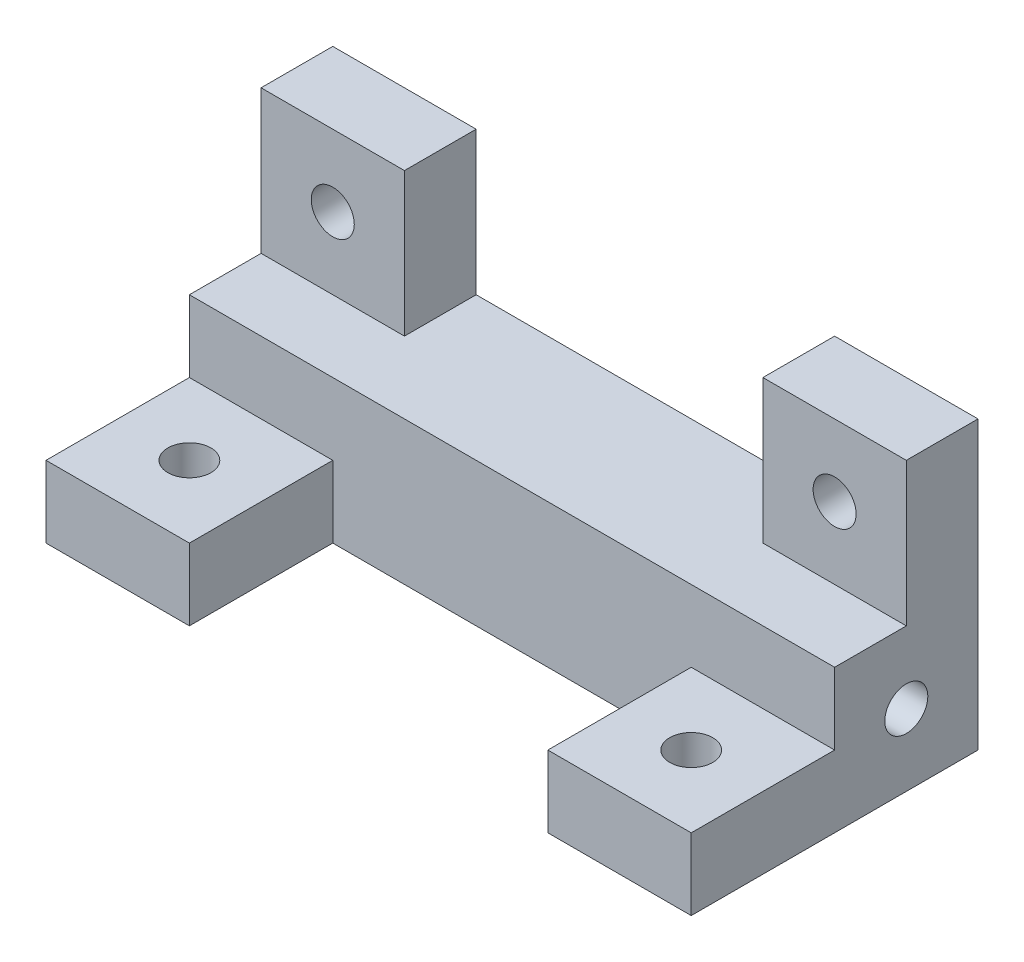
from build123d import *

# Parameters (mm, degrees)
SKETCH1_W           = 45
SKETCH1_H           = 10
BOSS_EXTRUDE1_DEPTH = 10
SKETCH2_W           = 10
SKETCH2_H           = 5
BOSS_EXTRUDE2_DEPTH = 10
SKETCH3_W           = 10
SKETCH3_H           = 5
BOSS_EXTRUDE3_DEPTH = 10
SKETCH4_R           = 1.5
CUT_EXTRUDE1_DEPTH  = 5
SKETCH5_R           = 1.5
CUT_EXTRUDE2_DEPTH  = 5
SKETCH6_R           = 1.5
CUT_EXTRUDE3_DEPTH  = 5
CUT_EXTRUDE4_START  = -5
SKETCH7_R           = 1.5
CUT_EXTRUDE4_DEPTH  = 5
SKETCH8_R           = 1.5
CUT_EXTRUDE5_DEPTH  = 5
SKETCH9_R           = 1.5
CUT_EXTRUDE6_DEPTH  = 5


with BuildPart() as part:
    # Sketch1 → Boss-Extrude1 (new body)
    with BuildSketch(Plane.XY):
        with Locations((22.5, 5)):
            Rectangle(SKETCH1_W, SKETCH1_H)
    extrude(amount=BOSS_EXTRUDE1_DEPTH)

    # Sketch2 → Boss-Extrude2 (add)
    with BuildSketch(Plane(origin=(0, 10, 0), x_dir=(1, 0, 0), z_dir=(0, 1, 0))):
        with Locations((5, -2.5)):
            Rectangle(SKETCH2_W, SKETCH2_H)
        with Locations((40, -2.5)):
            Rectangle(SKETCH2_W, SKETCH2_H)
    extrude(amount=BOSS_EXTRUDE2_DEPTH)

    # Sketch3 → Boss-Extrude3 (add)
    with BuildSketch(Plane.XY.offset(10)):
        with Locations((5, 2.5)):
            Rectangle(SKETCH3_W, SKETCH3_H)
        with Locations((40, 2.5)):
            Rectangle(SKETCH3_W, SKETCH3_H)
    extrude(amount=BOSS_EXTRUDE3_DEPTH)

    # Sketch4 → Cut-Extrude1 (cut)
    with BuildSketch(Plane.ZY):
        with Locations((5, 5)):
            Circle(SKETCH4_R)
    extrude(amount=-CUT_EXTRUDE1_DEPTH, mode=Mode.SUBTRACT)

    # Sketch5 → Cut-Extrude2 (cut)
    with BuildSketch(Plane.XY.offset(5)):
        with Locations((5, 15)):
            Circle(SKETCH5_R)
    extrude(amount=-CUT_EXTRUDE2_DEPTH, mode=Mode.SUBTRACT)

    # Sketch6 → Cut-Extrude3 (cut)
    with BuildSketch(Plane(origin=(0, 5, 0), x_dir=(1, 0, 0), z_dir=(0, 1, 0))):
        with Locations((5, -15)):
            Circle(SKETCH6_R)
    extrude(amount=-CUT_EXTRUDE3_DEPTH, mode=Mode.SUBTRACT)

    # Sketch7 → Cut-Extrude4 (cut)
    with BuildSketch(Plane(origin=(45, 0, 0), x_dir=(0, 0, -1), z_dir=(1, 0, 0)).offset(CUT_EXTRUDE4_START)):
        with Locations((-5, 5)):
            Circle(SKETCH7_R)
    extrude(amount=CUT_EXTRUDE4_DEPTH, mode=Mode.SUBTRACT)

    # Sketch8 → Cut-Extrude5 (cut)
    with BuildSketch(Plane.XY.offset(5)):
        with Locations((40, 15)):
            Circle(SKETCH8_R)
    extrude(amount=-CUT_EXTRUDE5_DEPTH, mode=Mode.SUBTRACT)

    # Sketch9 → Cut-Extrude6 (cut)
    with BuildSketch(Plane(origin=(0, 5, 0), x_dir=(1, 0, 0), z_dir=(0, 1, 0))):
        with Locations((40, -15)):
            Circle(SKETCH9_R)
    extrude(amount=-CUT_EXTRUDE6_DEPTH, mode=Mode.SUBTRACT)


solid = part.part
